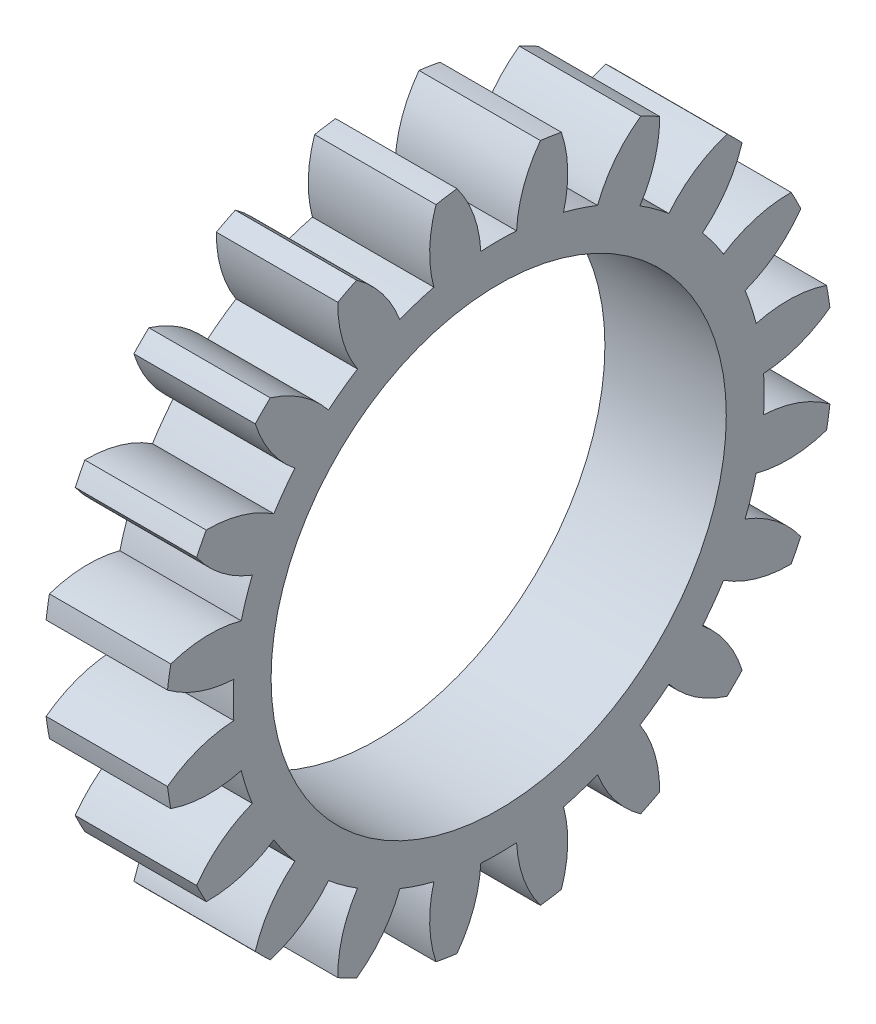
from build123d import *

# Parameters (mm, degrees)
BASPROSKE_W     = 4
BASPROSKE_H     = 11
TOOTHCUT_DEPTH  = 17.062378404
TEETHCUTS_COUNT = 20
TEETHCUTS_ANGLE = 342
BORSKE_R        = 7.5
BORE_DEPTH      = 50.0000508


with BuildPart() as part:
    # BasProSke → Base-Revolve (revolve)
    with BuildSketch(Plane(origin=(0, 0, 0), x_dir=(1, 0, 0), z_dir=(0, 1, 0))):
        with Locations((2, 5.5)):
            Rectangle(BASPROSKE_W, BASPROSKE_H)
    revolve(axis=Axis((-10, 0, 0), (1, 0, 0)))

    # TooCutSke → ToothCut (cut, through all)
    with BuildSketch(Plane(origin=(0, 0, 0), x_dir=(0, 0, -1), z_dir=(1, 0, 0))):
        with BuildLine():
            ThreePointArc((0.589353609, 8.729127295), (0, 8.749), (-0.589353609, 8.729127295))
            ThreePointArc((-0.589353609, 8.729127295), (-0.82475631, 9.893403384), (-1.391689312, 10.937213814))
            ThreePointArc((-1.391689312, 10.937213814), (0, 11.0254), (1.391689312, 10.937213814))
            ThreePointArc((1.391689312, 10.937213814), (0.82475631, 9.893403384), (0.589353609, 8.729127295))
        make_face()
    toothcut = extrude(amount=TOOTHCUT_DEPTH, mode=Mode.SUBTRACT)

    # TeethCuts: ToothCut ×20 about axis
    teethcuts_axis = Axis((-10, 0, 0), (1, 0, 0))
    for i in range(1, TEETHCUTS_COUNT):
        add(toothcut.rotate(teethcuts_axis, i * TEETHCUTS_ANGLE / (TEETHCUTS_COUNT - 1)), mode=Mode.SUBTRACT)

    # BorSke → Bore (cut, symmetric)
    with BuildSketch(Plane(origin=(0, 0, 0), x_dir=(0, 0, -1), z_dir=(1, 0, 0))):
        Circle(BORSKE_R)
    extrude(amount=BORE_DEPTH, both=True, mode=Mode.SUBTRACT)


solid = part.part
